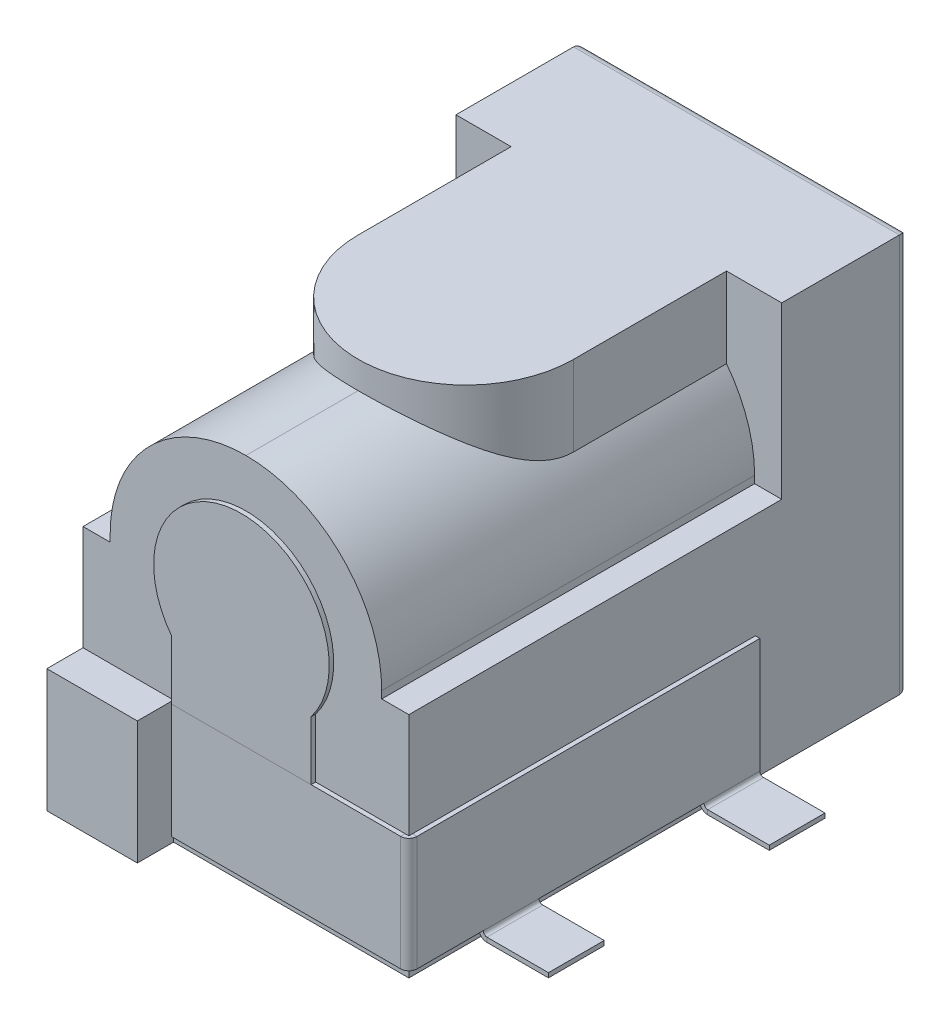
from build123d import *

# Parameters (mm, degrees)
SKETCH1_W               = 9
SKETCH1_H               = 11
BOSS_EXTRUDE1_DEPTH     = 13.8
SKETCH2_R               = 2.75
CUT_EXTRUDE1_DEPTH      = 11
CUT_EXTRUDE2_DEPTH      = 0.75
SKETCH4_R               = 1.05
BOSS_EXTRUDE2_DEPTH     = 9.2
FILLET2_R               = 1.05
SKETCH6_W               = 0.75
SKETCH6_H               = 10.3
CUT_EXTRUDE3_DEPTH      = 3.95
FILLET3_R               = 3.75
BASE_FLANGE1_DEPTH      = 3.17
BOSS_EXTRUDE4_DEPTH     = 0.125
FILLET4_R               = 0.25
BASE_FLANGE2_DEPTH      = 0.77
BASE_FLANGE2_DEPTH_BACK = 0.77
LPATTERN1_COUNT         = 2
LPATTERN1_PITCH         = 6.1
SKETCH27_W              = 2.5
SKETCH27_H              = 3.4
BOSS_EXTRUDE5_DEPTH     = 1
BASE_FLANGE3_DEPTH      = 0.77
BASE_FLANGE3_DEPTH_BACK = 0.77
BASE_FLANGE4_DEPTH      = 0.77
BASE_FLANGE4_DEPTH_BACK = 0.77


# Sheet-metal steps are written as plain solids
with BuildPart() as part:
    # Sketch1 → Boss-Extrude1 (new body)
    with BuildSketch(Plane.XY):
        Rectangle(SKETCH1_W, SKETCH1_H)
    extrude(amount=BOSS_EXTRUDE1_DEPTH)

    # Sketch2 → Cut-Extrude1 (cut)
    with BuildSketch(Plane(origin=(0, 0, 0), x_dir=(-1, 0, 0), z_dir=(0, 0, -1))):
        with Locations((0, 1)):
            Circle(SKETCH2_R)
    extrude(amount=-CUT_EXTRUDE1_DEPTH, mode=Mode.SUBTRACT)

    # Sketch3 → Cut-Extrude2 (cut)
    with BuildSketch(Plane(origin=(0, 5.5, 0), x_dir=(1, 0, 0), z_dir=(0, 1, 0))):
        with BuildLine():
            Line((2.975, -7.725), (2.975, -3.5))
            Line((2.975, -3.5), (4.5, -3.5))
            Line((4.5, -3.5), (4.5, -13.8))
            Line((4.5, -13.8), (-4.5, -13.8))
            Line((-4.5, -13.8), (-4.5, -3.5))
            Line((-4.5, -3.5), (-2.975, -3.5))
            Line((-2.975, -3.5), (-2.975, -7.725))
            ThreePointArc((-2.975, -7.725), (0, -10.7), (2.975, -7.725))
        make_face()
    extrude(amount=-CUT_EXTRUDE2_DEPTH, mode=Mode.SUBTRACT)

    # Sketch4 → Boss-Extrude2 (add)
    with BuildSketch(Plane(origin=(0, 0, 11), x_dir=(-1, 0, 0), z_dir=(0, 0, -1))):
        with Locations((0, 1)):
            Circle(SKETCH4_R)
    extrude(amount=BOSS_EXTRUDE2_DEPTH)

    # Fillet2
    fillet2_edges = [part.edges().sort_by_distance(p)[0] for p in [
        (1.05, 1, 1.8),
    ]]
    fillet(fillet2_edges, radius=FILLET2_R)

    # Sketch6 → Cut-Extrude3 (cut)
    with BuildSketch(Plane(origin=(0, 4.75, 0), x_dir=(1, 0, 0), z_dir=(0, 1, 0))):
        with Locations((4.125, -8.65)):
            Rectangle(SKETCH6_W, SKETCH6_H)
        with Locations((-4.125, -8.65)):
            Rectangle(SKETCH6_W, SKETCH6_H)
    extrude(amount=-CUT_EXTRUDE3_DEPTH, mode=Mode.SUBTRACT)

    # Fillet3
    fillet3_edges = [part.edges().sort_by_distance(p)[0] for p in [
        (3.75, 4.75, 8.65),
        (-3.75, 4.75, 8.65),
    ]]
    fillet(fillet3_edges, radius=FILLET3_R - 0.0001)  # a hair under: the kernel refuses the full size

    # Fillet4
    fillet4_edges = [part.edges().sort_by_distance(p)[0] for p in [
        (-4.5, 0, 0),
        (0, 5.5, 0),
        (4.5, 0, 0),
        (0, -5.5, 0),
    ]]
    fillet(fillet4_edges, radius=FILLET4_R)



with BuildPart() as body_2:
    # Sketch9 → Base-Flange1 (new body)
    with BuildSketch(Plane.XZ.offset(5.27)):
        with BuildLine():
            Line((-1.925, 13.925), (4.4, 13.925))
            ThreePointArc((4.4, 13.925), (4.559099026, 13.859099026), (4.625, 13.7))
            Line((4.625, 13.7), (4.625, 4.23))
            Line((4.625, 4.23), (4.5, 4.23))
            Line((4.5, 4.23), (4.5, 13.7))
            ThreePointArc((4.5, 13.7), (4.470710678, 13.770710678), (4.4, 13.8))
            Line((4.4, 13.8), (-1.925, 13.8))
            Line((-1.925, 13.8), (-1.925, 13.925))
        make_face()
    extrude(amount=-BASE_FLANGE1_DEPTH)


with BuildPart() as body_3:
    # Sketch14 → Boss-Extrude4 (new body)
    with BuildSketch(Plane(origin=(-10.664949063, -1.262516382, 13.925), x_dir=(1, 0, 0), z_dir=(0, 0, 1))):
        with BuildLine():
            Line((8.739949063, -0.837483618), (8.739949063, 0.787728261))
            ThreePointArc((8.739949063, 0.787728261), (10.664949063, 4.687516382), (12.589949063, 0.787728261))
            Line((12.589949063, 0.787728261), (12.589949063, -0.837483618))
            Line((12.589949063, -0.837483618), (8.739949063, -0.837483618))
        make_face()
    extrude(amount=-BOSS_EXTRUDE4_DEPTH)


with BuildPart() as body_4:
    # Sketch20 → Base-Flange2 (new, two sides: drawn at the far end of the back side and taken through both)
    with BuildSketch(Plane(origin=(0, 0, 11.1), x_dir=(-1, 0, 0), z_dir=(0, 0, -1)).offset(-BASE_FLANGE2_DEPTH_BACK)):
        with BuildLine():
            Line((-4.625, -5.27), (-4.625, -5.275))
            ThreePointArc((-4.625, -5.275), (-4.654289322, -5.345710678), (-4.725, -5.375))
            Line((-4.725, -5.375), (-6.425, -5.375))
            Line((-6.425, -5.375), (-6.425, -5.5))
            Line((-6.425, -5.5), (-4.725, -5.5))
            ThreePointArc((-4.725, -5.5), (-4.565900974, -5.434099026), (-4.5, -5.275))
            Line((-4.5, -5.275), (-4.5, -5.27))
            Line((-4.5, -5.27), (-4.625, -5.27))
        make_face()
    extrude(amount=BASE_FLANGE2_DEPTH + BASE_FLANGE2_DEPTH_BACK)


with BuildPart() as lpattern1_1:
    # LPattern1: pattern copy
    add(body_4.part.moved(Location(Vector(0, 0, -1) * (1 * LPATTERN1_PITCH))))


with BuildPart() as part_1:
    add(part.part)

    add(body_3.part)  # Boss-Extrude5 merges body 3
    # Sketch27 → Boss-Extrude5 (add)
    with BuildSketch(Plane.XY.offset(13.8)):
        with Locations((-3.25, -3.8)):
            Rectangle(SKETCH27_W, SKETCH27_H)
    extrude(amount=BOSS_EXTRUDE5_DEPTH)


with BuildPart() as body_5:
    # Sketch28 → Base-Flange3 (new, two sides: drawn at the far end of the back side and taken through both)
    with BuildSketch(Plane(origin=(0, 0, 11.1), x_dir=(-1, 0, 0), z_dir=(0, 0, -1)).offset(-BASE_FLANGE3_DEPTH_BACK)):
        with BuildLine():
            Line((4.5, -2), (4.51, -2))
            ThreePointArc((4.51, -2), (4.580710678, -2.029289322), (4.61, -2.1))
            Line((4.61, -2.1), (4.61, -5.275))
            ThreePointArc((4.61, -5.275), (4.675900974, -5.434099026), (4.835, -5.5))
            Line((4.835, -5.5), (6.41, -5.5))
            Line((6.41, -5.5), (6.41, -5.375))
            Line((6.41, -5.375), (4.835, -5.375))
            ThreePointArc((4.835, -5.375), (4.764289322, -5.345710678), (4.735, -5.275))
            Line((4.735, -5.275), (4.735, -2.1))
            ThreePointArc((4.735, -2.1), (4.669099026, -1.940900974), (4.51, -1.875))
            Line((4.51, -1.875), (4.5, -1.875))
            Line((4.5, -1.875), (4.5, -2))
        make_face()
    extrude(amount=BASE_FLANGE3_DEPTH + BASE_FLANGE3_DEPTH_BACK)


with BuildPart() as body_6:
    # Sketch31 → Base-Flange4 (new, two sides: drawn at the far end of the back side and taken through both)
    with BuildSketch(Plane.XY.offset(5).offset(-BASE_FLANGE4_DEPTH_BACK)):
        with BuildLine():
            Line((-4.5, -4), (-4.51, -4))
            ThreePointArc((-4.51, -4), (-4.580710678, -4.029289322), (-4.61, -4.1))
            Line((-4.61, -4.1), (-4.61, -5.275))
            ThreePointArc((-4.61, -5.275), (-4.675900974, -5.434099026), (-4.835, -5.5))
            Line((-4.835, -5.5), (-6.41, -5.5))
            Line((-6.41, -5.5), (-6.41, -5.375))
            Line((-6.41, -5.375), (-4.835, -5.375))
            ThreePointArc((-4.835, -5.375), (-4.764289322, -5.345710678), (-4.735, -5.275))
            Line((-4.735, -5.275), (-4.735, -4.1))
            ThreePointArc((-4.735, -4.1), (-4.669099026, -3.940900974), (-4.51, -3.875))
            Line((-4.51, -3.875), (-4.5, -3.875))
            Line((-4.5, -3.875), (-4.5, -4))
        make_face()
    extrude(amount=BASE_FLANGE4_DEPTH + BASE_FLANGE4_DEPTH_BACK)


solid = Compound([body_2.part, body_4.part, lpattern1_1.part, part_1.part, body_5.part, body_6.part])
